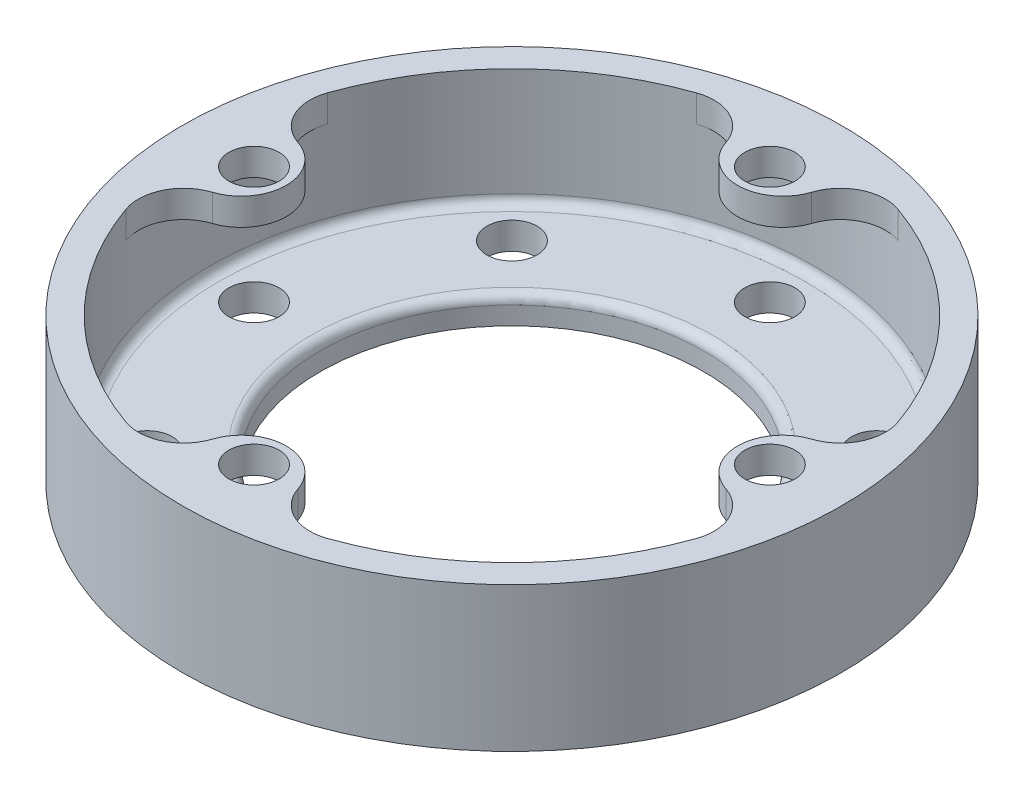
from build123d import *

# Parameters (mm, degrees)
SKETCH1_R             = 73.02499999999999
BASE_EXTRUDE_DEPTH    = 32
SHELL1_T              = -6
SKETCH4_R             = 42.5
CUT_EXTRUDE2_DEPTH    = 107.49554568149786
BOSS_EXTRUDE1_START   = -6
BOSS_EXTRUDE1_DEPTH   = 6
CUT_EXTRUDE1_REACH    = 110.117
SKETCH3_R             = 5.556250000000003
FILLET1_R             = 10
CIRPATTERN1_START     = 26
CIRPATTERN1_OUTLINE_R = 5.55625
CIRPATTERN1_DEPTH     = 6
SKETCH5_R             = 5.5562499999999995
CUT_EXTRUDE3_DEPTH    = 107.49554568149786
CIRPATTERN2_COUNT     = 8
FILLET2_R             = 2


# Read off the part's stored shape, not the designer's step: CirPattern1
with BuildPart() as part:
    # Sketch1 → Base-Extrude (new body)
    with BuildSketch(Plane(origin=(0, 0, 0), x_dir=(1, 0, 0), z_dir=(0, 1, 0))):
        with Locations(Location((0, 0, 0), (0, 0, 270))):
            Circle(SKETCH1_R)
    extrude(amount=BASE_EXTRUDE_DEPTH)

    # Shell1
    shell1_openings = [part.faces().sort_by_distance(p)[0] for p in [
        (0, 32, 0),
    ]]
    offset(amount=SHELL1_T, openings=shell1_openings, kind=Kind.INTERSECTION)

    # Sketch4 → Cut-Extrude2 (cut, through all)
    with BuildSketch(Plane(origin=(0, 6, 0), x_dir=(-1, 0, 0), z_dir=(0, 1, 0))):
        with Locations(Location((0, 0, 0), (0, 0, 90))):
            Circle(SKETCH4_R)
    extrude(amount=-CUT_EXTRUDE2_DEPTH, mode=Mode.SUBTRACT)

    # Sketch2 → Boss-Extrude1 (add)
    with BuildSketch(Plane(origin=(0, 32, 0), x_dir=(-1, 0, 0), z_dir=(0, 1, 0)).offset(BOSS_EXTRUDE1_START)):
        with BuildLine():
            Line((-10, -66.2748113916592), (-10.000000000000002, -60))
            ThreePointArc((-10.000000000000002, -60), (6.1e-16, -50), (10.000000000000002, -60))
            Line((10.000000000000002, -60), (10, -66.2748113916592))
            ThreePointArc((10, -66.2748113916592), (4.1e-15, -67.025), (-10, -66.2748113916592))
        make_face()
    extrude(amount=BOSS_EXTRUDE1_DEPTH)

    # Sketch3 → Cut-Extrude1 (cut, up to next)
    with BuildSketch(Plane(origin=(0, 32, 0), x_dir=(-1, 0, 0), z_dir=(0, 1, 0)), mode=Mode.PRIVATE) as cut_extrude1_sk1:
        with Locations(Location((0, -57.15, 0), (0, 0, 90))):
            Circle(SKETCH3_R)
    cut_extrude1_tool1 = extrude(cut_extrude1_sk1.sketch, amount=-CUT_EXTRUDE1_REACH, mode=Mode.PRIVATE) & part.part
    add(cut_extrude1_tool1.solids().sort_by_distance((0, 32, -57.15))[0], mode=Mode.SUBTRACT)

    # Fillet1
    # the kernel refuses this fillet: 10 mm, written as the material it adds along each edge
    with BuildSketch(Plane(origin=(-10, 26, -66.2748113916592), x_dir=(-0.9701975992625391, 0, 0.24231512207290193), z_dir=(0, 1, 0))) as fillet1_piece_1:
        with BuildLine():
            CenterArc((11.76631234828467, 9.95491445348666), FILLET1_R, 184.14023221581692, 91.30253304935542)
            Line((1.7924090220068125, 9.232936311114328), (0.7950186893790265, 9.160738496877093))
            ThreePointArc((0.7950186893790265, 9.160738496877093), (0.5502840890917953, 6.3301220700858885), (-0.9701975992625391, 0.24231512207290193))
            Line((-0.9701975992625391, 0.24231512207290193), (-0.09485136919214045, -0.9954914453486712))
            ThreePointArc((-0.09485136919214045, -0.9954914453486712), (6.357413020103008, -1.3021858755056244), (12.809677409398176, -0.9954914453486696))
            Line((12.809677409398176, -0.9954914453486696), (12.714826040206038, 1.7e-16))
        make_face()
    extrude(amount=6)
    with BuildSketch(Plane(origin=(10, 26, -66.2748113916592), x_dir=(0.970197599262539, 0, 0.24231512207290234), z_dir=(0, 1, 0))) as fillet1_piece_2:
        with BuildLine():
            CenterArc((11.766312348284657, -9.95491445348666), FILLET1_R, 84.55723473482769, 91.30253304935547)
            Line((1.792409022006801, -9.232936311114338), (0.7950186893790149, -9.160738496877103))
            ThreePointArc((0.7950186893790149, -9.160738496877103), (0.550284089091798, -6.3301220700858885), (-0.970197599262539, -0.24231512207290234))
            Line((-0.970197599262539, -0.24231512207290234), (-0.09485136919213914, 0.9954914453486715))
            ThreePointArc((-0.09485136919213914, 0.9954914453486715), (6.357413020103015, 1.3021858755056288), (12.809677409398152, 0.995491445348669))
            Line((12.809677409398152, 0.995491445348669), (12.714826040206018, 1.7e-16))
        make_face()
    extrude(amount=6)
    # the kernel refuses this fillet: 10 mm, written as the material it takes off along each edge

    # CirPattern1 outline → CirPattern1 (add)
    # profile 1 of 3: a face of its own
    with BuildSketch(Plane(origin=(0, 0, 0), x_dir=(1, 0, 0), z_dir=(0, 1, 0)).offset(CIRPATTERN1_START)):
        with BuildLine():
            ThreePointArc((-63.193816801, -22.335893605), (-62.73913957, -14.590668353), (-56.882710952, -9.501710756))
            ThreePointArc((-56.882710952, -9.501710756), (-50, 7.4e-08), (-56.882710923, 9.501710926))
            ThreePointArc((-56.882710923, 9.501710926), (-62.739139527, 14.59066854), (-63.193816734, 22.335893794))
            ThreePointArc((-63.193816734, 22.335893794), (-67.025, 1e-07), (-63.193816801, -22.335893605))
        make_face()
        with Locations((-57.15, 8.5e-08)):
            Circle(CIRPATTERN1_OUTLINE_R, mode=Mode.SUBTRACT)
    # profile 2 of 3: a face of its own
    with BuildSketch(Plane(origin=(0, 0, 0), x_dir=(1, 0, 0), z_dir=(0, 1, 0)).offset(CIRPATTERN1_START)):
        with BuildLine():
            ThreePointArc((-9.501711011, -56.882710909), (-14.590668634, -62.739139505), (-22.335893888, -63.193816701))
            ThreePointArc((-22.335893888, -63.193816701), (-2e-07, -67.025), (22.33589351, -63.193816834))
            ThreePointArc((22.33589351, -63.193816834), (14.590668259, -62.739139592), (9.501710671, -56.882710966))
            ThreePointArc((9.501710671, -56.882710966), (-1.49e-07, -50), (-9.501711011, -56.882710909))
        make_face()
        with Locations((-1.71e-07, -57.15)):
            Circle(CIRPATTERN1_OUTLINE_R, mode=Mode.SUBTRACT)
    # profile 3 of 3: a face of its own
    with BuildSketch(Plane(origin=(0, 0, 0), x_dir=(1, 0, 0), z_dir=(0, 1, 0)).offset(CIRPATTERN1_START)):
        with BuildLine():
            ThreePointArc((63.193816667, -22.335893983), (67.025, -3.01e-07), (63.193816868, 22.335893416))
            ThreePointArc((63.193816868, 22.335893416), (62.739139614, 14.590668165), (56.88271098, 9.501710585))
            ThreePointArc((56.88271098, 9.501710585), (50, -2.25e-07), (56.882710895, -9.501711096))
            ThreePointArc((56.882710895, -9.501711096), (62.739139483, -14.590668728), (63.193816667, -22.335893983))
        make_face()
        with Locations((57.15, -2.56e-07)):
            Circle(CIRPATTERN1_OUTLINE_R, mode=Mode.SUBTRACT)
    extrude(amount=CIRPATTERN1_DEPTH)

    # Sketch5 → Cut-Extrude3 (cut, through all)
    with BuildSketch(Plane(origin=(0, 6, 0), x_dir=(-1, 0, 0), z_dir=(0, 1, 0))):
        with Locations(Location((0, -57.15, 0), (0, 0, 90))):
            Circle(SKETCH5_R)
    cut_extrude3 = extrude(amount=-CUT_EXTRUDE3_DEPTH, mode=Mode.SUBTRACT)

    # CirPattern2: Cut-Extrude3 ×8 about axis
    cirpattern2_axis = Axis((3.1e-16, 0, -1.3e-16), (0, 1, 0))
    for i in range(1, CIRPATTERN2_COUNT):
        add(cut_extrude3.rotate(cirpattern2_axis, i * 360 / CIRPATTERN2_COUNT), mode=Mode.SUBTRACT)

    # Fillet2
    fillet2_edges = [part.edges().sort_by_distance(p)[0] for p in [
        (7.81e-15, 6, -42.5),
        (4.1e-15, 6, -67.02499999999999),
    ]]
    fillet(fillet2_edges, radius=FILLET2_R)


solid = part.part
